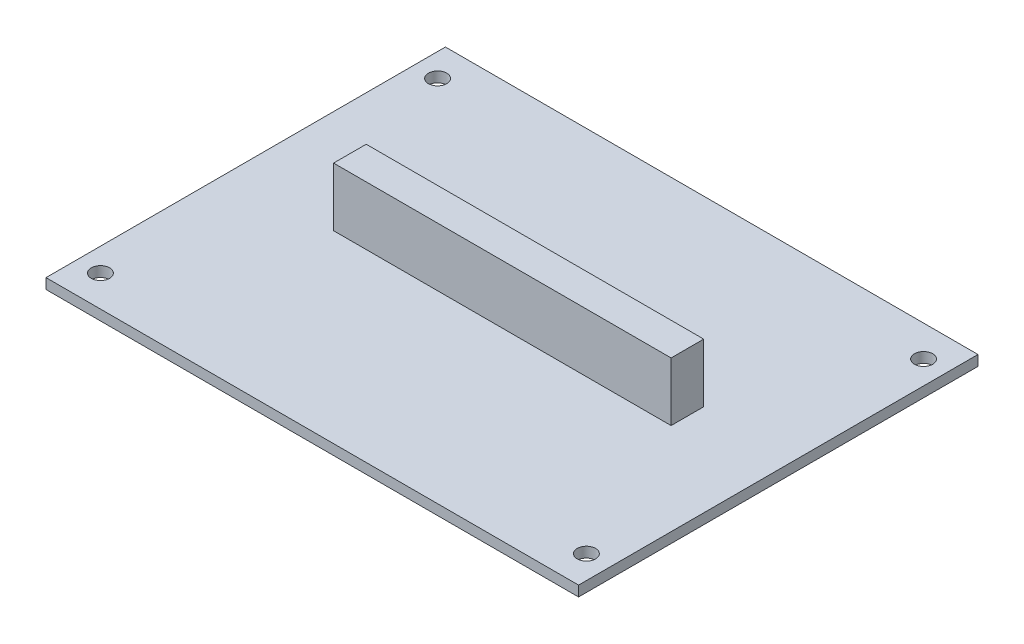
from build123d import *

# Parameters (mm, degrees)
SKETCH1_W           = 80
SKETCH1_H           = 60
SKETCH1_R           = 1.375
BOSS_EXTRUDE1_DEPTH = 1.55
SKETCH2_W           = 50.7
SKETCH2_H           = 4.9
BOSS_EXTRUDE2_DEPTH = 8.8


with BuildPart() as part:
    # Sketch1 → Boss-Extrude1 (new body)
    with BuildSketch(Plane(origin=(0, 0, 0), x_dir=(1, 0, 0), z_dir=(0, 1, 0))):
        Rectangle(SKETCH1_W, SKETCH1_H)
        with Locations((-36.5, 25.325)):
            Circle(SKETCH1_R, mode=Mode.SUBTRACT)
        with Locations((-36.5, -25.325)):
            Circle(SKETCH1_R, mode=Mode.SUBTRACT)
        with Locations((36.5, -25.325)):
            Circle(SKETCH1_R, mode=Mode.SUBTRACT)
        with Locations((36.5, 25.325)):
            Circle(SKETCH1_R, mode=Mode.SUBTRACT)
    extrude(amount=BOSS_EXTRUDE1_DEPTH)

    # Sketch2 → Boss-Extrude2 (add)
    with BuildSketch(Plane(origin=(0, 1.55, 0), x_dir=(1, 0, 0), z_dir=(0, 1, 0))):
        with Locations((0.85, 0.15)):
            Rectangle(SKETCH2_W, SKETCH2_H)
    extrude(amount=BOSS_EXTRUDE2_DEPTH)


solid = part.part
